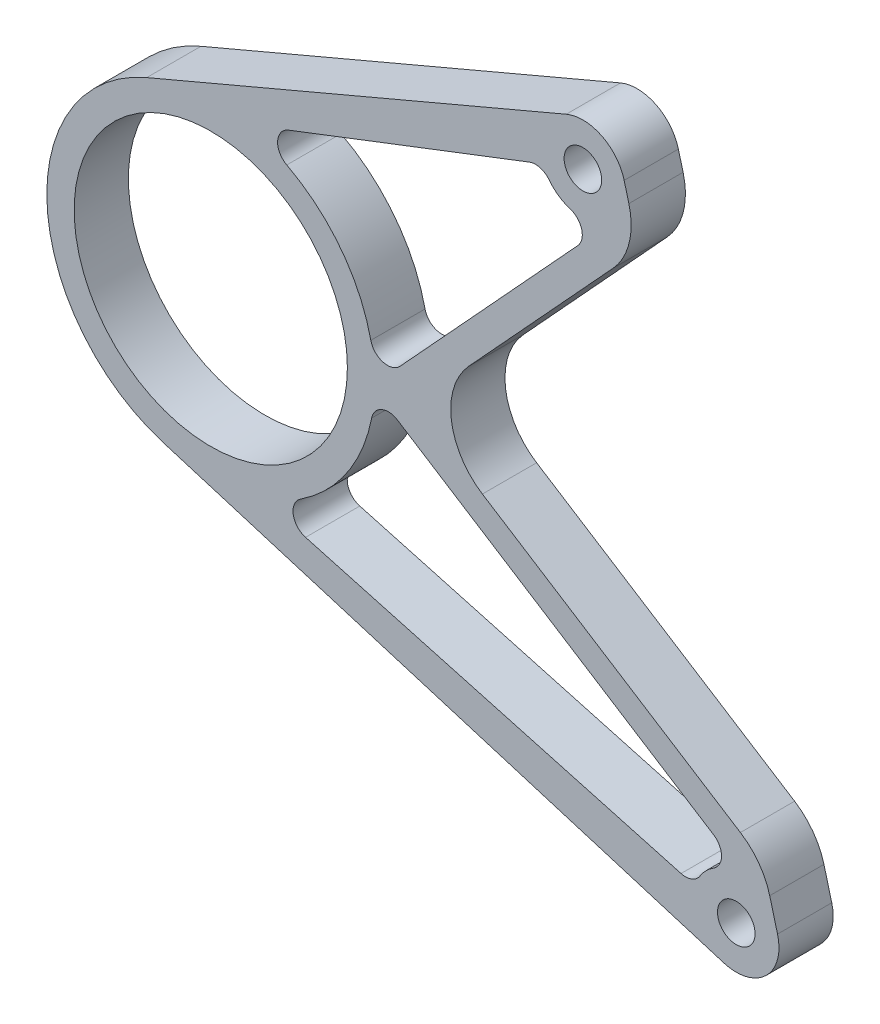
from build123d import *

# Parameters (mm, degrees)
SKETCH4_R           = 40
SKETCH4_R_2         = 5.5
BOSS_EXTRUDE1_DEPTH = 15.875
CUT_EXTRUDE2_DEPTH  = 265.729718277
FILLET1_R           = 5
CUT_EXTRUDE3_DEPTH  = 265.729718424
FILLET2_R           = 20


with BuildPart() as part:
    # Sketch4 → Boss-Extrude1 (new body)
    with BuildSketch(Plane.XY):
        with BuildLine():
            Line((-142.633865887, -146.080164327), (21.544941406, -195.965223983))
            ThreePointArc((21.544941406, -195.965223983), (33.862932788, -192.99616638), (37.258075063, -180.78874144))
            Line((37.258075063, -180.78874144), (-7.649527095, -12.138772571))
            ThreePointArc((-7.649527095, -12.138772571), (-14.239674224, -4.124786339), (-24.611636772, -3.848367419))
            Line((-24.611636772, -3.848367419), (-147.429933804, -55.967315581))
            ThreePointArc((-147.429933804, -55.967315581), (-176.611366682, -102.704491033), (-142.633865887, -146.080164327))
        make_face()
        with Locations((-128.679206861, -100.153402069)):
            Circle(SKETCH4_R, mode=Mode.SUBTRACT)
        with Locations((25.178967194, -184.005129645)):
            Circle(SKETCH4_R_2, mode=Mode.SUBTRACT)
        with Locations((-19.728634964, -15.355160776)):
            Circle(SKETCH4_R_2, mode=Mode.SUBTRACT)
    extrude(amount=BOSS_EXTRUDE1_DEPTH)

    # Sketch5 → Cut-Extrude2 (cut, through all)
    with BuildSketch(Plane.XY.offset(15.875)):
        with BuildLine():
            Line((-31.394262991, -19.845497372), (-118.286356862, -53.292024914))
            ThreePointArc((-118.286356862, -53.292024914), (-91.243550062, -70.110572642), (-80.679206861, -100.153402069))
            Line((-80.679206861, -100.153402069), (-10.524781522, -23.813238679))
            ThreePointArc((-10.524781522, -23.813238679), (-22.063335437, -27.635192278), (-31.394262991, -19.845497372))
        make_face()
        with BuildLine():
            ThreePointArc((-80.708447165, -101.828577911), (-90.303653302, -128.985968536), (-113.716587883, -145.761735006))
            Line((-113.716587883, -145.761735006), (13.127445592, -180.686873014))
            ThreePointArc((13.127445592, -180.686873014), (20.684837316, -172.340962438), (31.888396226, -173.458397351))
            Line((31.888396226, -173.458397351), (-80.708447165, -101.828577911))
        make_face()
    extrude(amount=-CUT_EXTRUDE2_DEPTH, mode=Mode.SUBTRACT)

    # Fillet1
    fillet1_edges = [part.edges().sort_by_distance(p)[0] for p in [
        (13.127445592, -180.686873014, 7.9375),
        (-80.708447165, -101.828577911, 7.9375),
        (-113.716587883, -145.761735006, 7.9375),
        (-80.679206861, -100.153402069, 7.9375),
        (-118.286356862, -53.292024914, 7.9375),
        (-10.524781522, -23.813238679, 7.9375),
        (-31.394262991, -19.845497372, 7.9375),
    ]]
    fillet(fillet1_edges, radius=FILLET1_R)
    fillet1_2_edges = [part.edges().sort_by_distance(p)[0] for p in [
        (31.888396226, -173.458397351, 7.9375),
    ]]
    fillet(fillet1_2_edges, radius=FILLET1_R)

    # Sketch6 → Cut-Extrude3 (cut, through all)
    with BuildSketch(Plane.XY.offset(15.875)):
        Polygon((-69.306214403, -99.600633953), (-3.444297399, -27.931462965), (32.963567977, -164.660770859), align=None)
    extrude(amount=-CUT_EXTRUDE3_DEPTH, mode=Mode.SUBTRACT)

    # Fillet2
    fillet2_edges = [part.edges().sort_by_distance(p)[0] for p in [
        (32.963567977, -164.660770859, 7.9375),
        (-69.306214403, -99.600633953, 7.9375),
        (-3.444297399, -27.931462965, 7.9375),
    ]]
    fillet(fillet2_edges, radius=FILLET2_R)


solid = part.part
